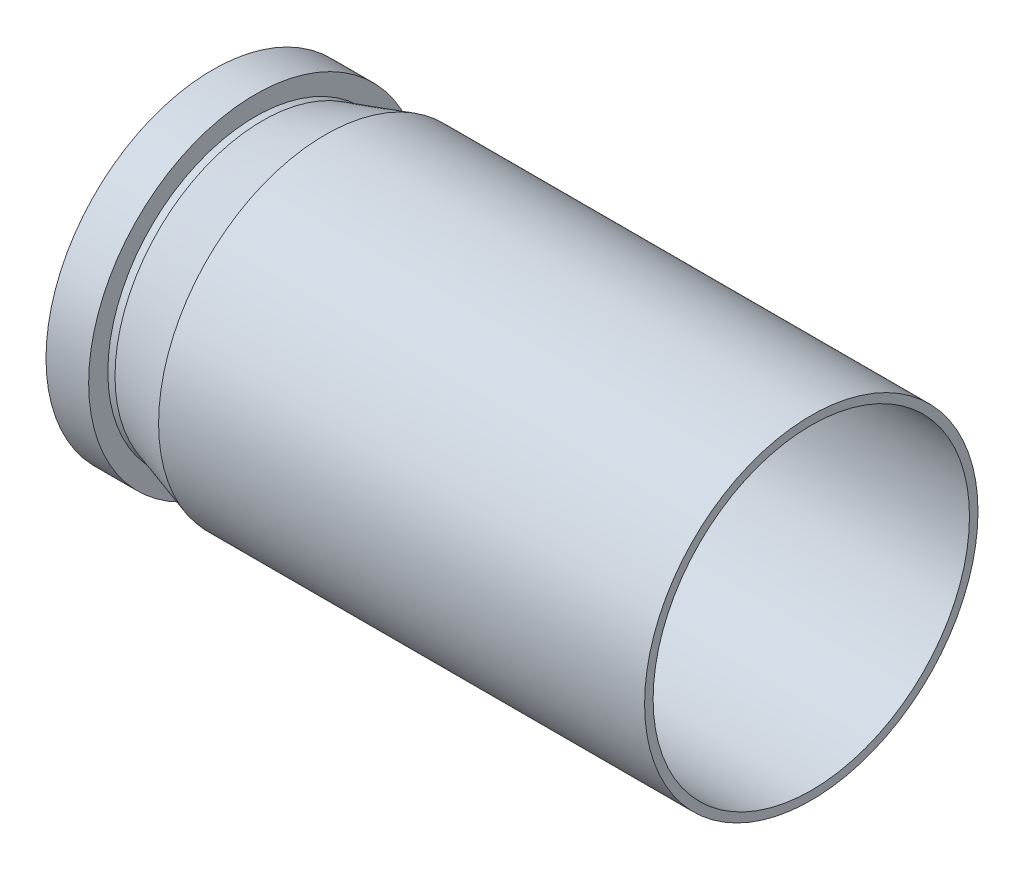
from build123d import *

# Parameters (mm, degrees)
CHANFRO4_SIZE   = 0.55
CHANFRO4_SIZE_2 = 1.79896894


with BuildPart() as part:
    # Esboço1 → Revolução1 (revolve)
    with BuildSketch(Plane.XY, mode=Mode.PRIVATE) as revolu_o1_sk:
        Polygon((4.16, 1), (4.16, 4.45), (16.84, 4.45), (16.84, 4.69), (3.2, 4.69), (3.2, 4.15), (1.2, 4.15), (1.2, 4.69), (0, 4.69), (0, 2.25), (3, 2.25), (3, 1), align=None)
    revolve(revolu_o1_sk.sketch.rotate(Axis((0, 0, 0), (1, 0, 0)), 90), axis=Axis((0, 0, 0), (1, 0, 0)))

    # Chanfro4
    # the kernel refuses this chamfer: 1.79896894, 0.55 mm, written as the material it adds along each edge
    with BuildSketch(Plane(origin=(3.2, 0, 0), x_dir=(0, 0, 1), z_dir=(0, 1, 0))) as chanfro4_piece_1_section:
        Polygon((4.15 + CHANFRO4_SIZE, 0), (4.15, -CHANFRO4_SIZE_2), (4.15, 0), align=None)
    chanfro4_piece_1 = revolve(axis=Axis((3.2, 0, 0), (1, 0, 0)), mode=Mode.PRIVATE)
    chanfro4_piece_1 = chanfro4_piece_1 & Plane(origin=(2.25712916, 0, 0), x_dir=(0, 0, 1), z_dir=(-1, 0, 0)) * Cylinder(4.69, 19, mode=Mode.PRIVATE)
    add(chanfro4_piece_1)


solid = part.part
